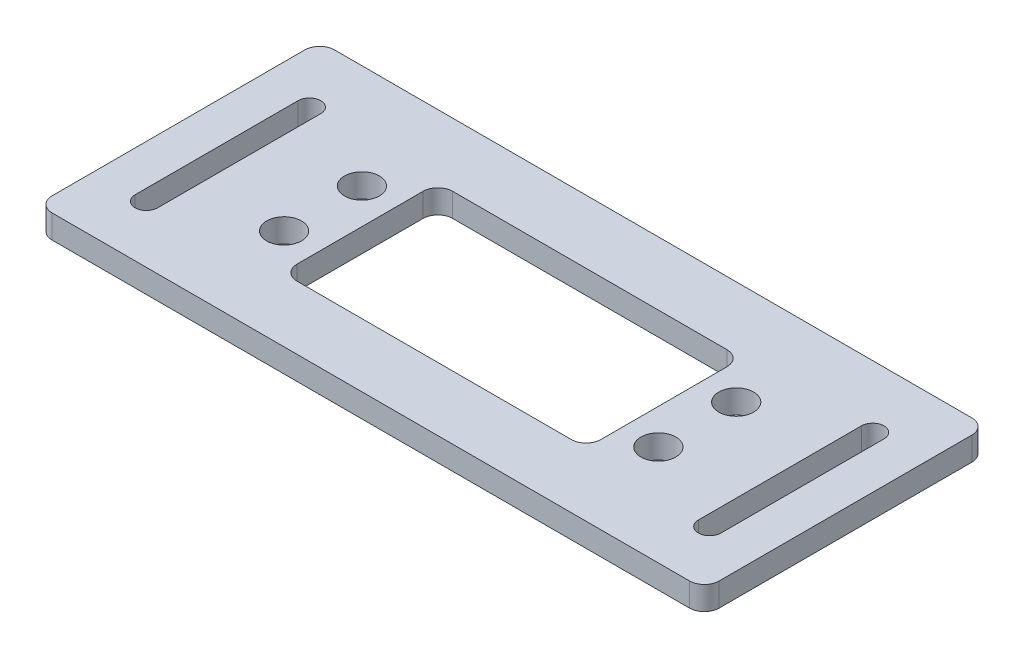
from build123d import *

# Parameters (mm, degrees)
SKETCH1_W           = 90
SKETCH1_H           = 38.1
BOSS_EXTRUDE1_DEPTH = 3.175
SKETCH2_R           = 2.35
SKETCH2_W           = 41
SKETCH2_H           = 21
CUT_EXTRUDE1_DEPTH  = 49.969205885
FILLET1_R           = 2
CUT_EXTRUDE2_DEPTH  = 49.969205885


with BuildPart() as part:
    # Sketch1 → Boss-Extrude1 (new body)
    with BuildSketch(Plane(origin=(0, 0, 0), x_dir=(1, 0, 0), z_dir=(0, 1, 0))):
        Rectangle(SKETCH1_W, SKETCH1_H)
    extrude(amount=BOSS_EXTRUDE1_DEPTH)

    # Sketch2 → Cut-Extrude1 (cut, through all)
    with BuildSketch(Plane(origin=(0, 3.175, 0), x_dir=(1, 0, 0), z_dir=(0, 1, 0))):
        with Locations((-25.25, 5)):
            Circle(SKETCH2_R)
        with Locations((-25.25, -5.503329438)):
            Circle(SKETCH2_R)
        with Locations((25.25, 5)):
            Circle(SKETCH2_R)
        with Locations((25.25, -5.503329438)):
            Circle(SKETCH2_R)
        Rectangle(SKETCH2_W, SKETCH2_H)
    extrude(amount=-CUT_EXTRUDE1_DEPTH, mode=Mode.SUBTRACT)

    # Fillet1
    fillet1_edges = [part.edges().sort_by_distance(p)[0] for p in [
        (20.5, 1.5875, -10.5),
        (20.5, 1.5875, 10.5),
        (-20.5, 1.5875, 10.5),
        (-20.5, 1.5875, -10.5),
        (-45, 1.5875, -19.05),
        (45, 1.5875, -19.05),
        (45, 1.5875, 19.05),
        (-45, 1.5875, 19.05),
    ]]
    fillet(fillet1_edges, radius=FILLET1_R)

    # Sketch3 → Cut-Extrude2 (cut, through all)
    with BuildSketch(Plane(origin=(0, 3.175, 0), x_dir=(1, 0, 0), z_dir=(0, 1, 0))):
        with BuildLine():
            Line((-36.475, 10.670041553), (-36.475, -11.329958447))
            ThreePointArc((-36.475, -11.329958447), (-38, -12.854958447), (-39.525, -11.329958447))
            Line((-39.525, -11.329958447), (-39.525, 10.670041553))
            ThreePointArc((-39.525, 10.670041553), (-38, 12.195041553), (-36.475, 10.670041553))
        make_face()
        with BuildLine():
            Line((36.475, 10.670041553), (36.475, -11.329958447))
            ThreePointArc((36.475, -11.329958447), (38, -12.854958447), (39.525, -11.329958447))
            Line((39.525, -11.329958447), (39.525, 10.670041553))
            ThreePointArc((39.525, 10.670041553), (38, 12.195041553), (36.475, 10.670041553))
        make_face()
    extrude(amount=-CUT_EXTRUDE2_DEPTH, mode=Mode.SUBTRACT)


solid = part.part
